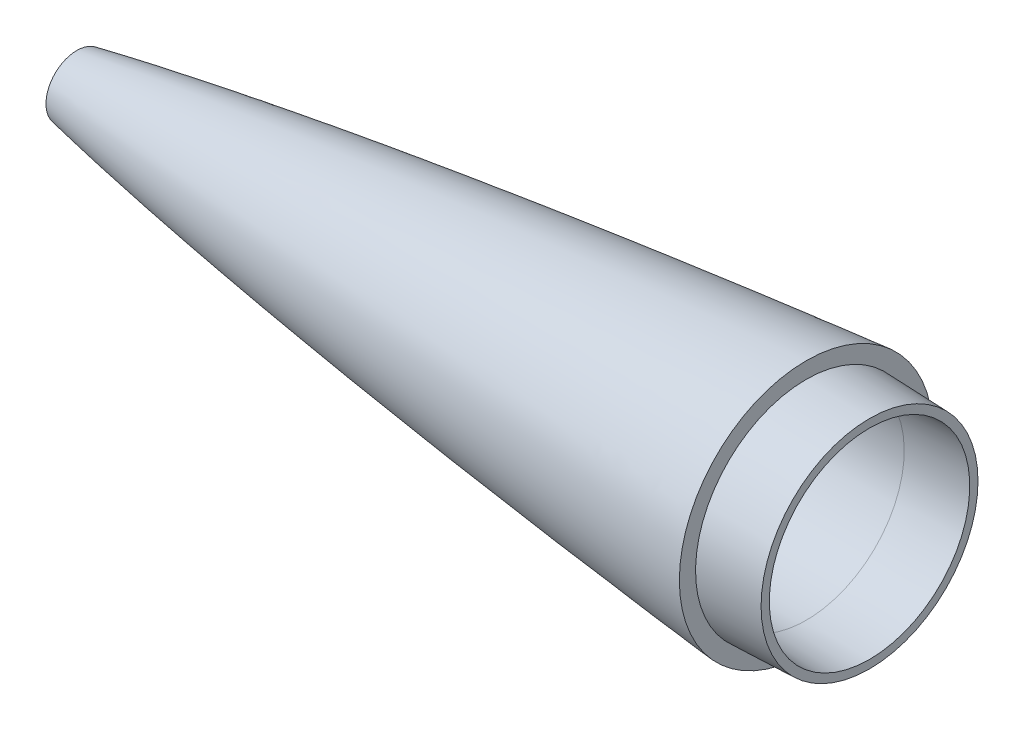
from build123d import *

# Parameters (mm, degrees)
SKETCH15_R         = 7.1
CUT_EXTRUDE1_DEPTH = 10
CUT_EXTRUDE1_DRAFT = -4


# Read off the part's stored shape, not the designer's step: Boss-Extrude1
with BuildPart() as part:
    # Sketch1 → Revolve1 (revolve)
    with BuildSketch(Plane.XY):
        with BuildLine():
            Line((-87.413336082, 34.5), (0, 34.5))
            Line((0, 34.5), (0, 39.5))
            Line((0, 39.5), (-10, 39.5))
            Line((-10, 39.5), (-10, 42.5))
            add(Edge.make_bspline(
                [(-410, 0), (-409.996104343, 0.009764497), (-409.985913153, 0.027949075), (-409.957510571, 0.059414303), (-409.898233488, 0.114206215), (-409.810537783, 0.179970098), (-409.676312366, 0.268169047), (-409.483787304, 0.379593537), (-409.212469032, 0.520885741), (-408.782228648, 0.722476645), (-408.063332817, 1.024430726), (-406.77961993, 1.501919518), (-404.418121728, 2.27068301), (-399.978466324, 3.520524256), (-392.218905515, 5.393132921), (-378.995085532, 8.137030847), (-360.816525389, 11.376409579), (-338.763877653, 14.839380374), (-314.223443016, 18.290822778), (-289.643356303, 21.444587663), (-265.032848706, 24.35089646), (-240.39799038, 27.041916752), (-215.742482432, 29.536512433), (-191.069036766, 31.846533123), (-166.379459519, 33.977380219), (-141.675128406, 35.929637856), (-120.046737987, 37.477295551), (-101.49987599, 38.68219301), (-86.03878208, 39.598684687), (-73.666707864, 40.275756821), (-61.291427842, 40.89196691), (-50.460249117, 41.371928643), (-41.174361888, 41.734883373), (-33.711978303, 41.990289017), (-28.074032831, 42.161616919), (-23.34821361, 42.285186922), (-19.53483297, 42.370797081), (-16.35677709, 42.429342551), (-13.814187886, 42.46970241), (-11.907137026, 42.488580832), (-10.635720501, 42.5), (-10, 42.5)],
                knots=[0, 0, 0, 0, 0, 0.000103977, 0.000207953, 0.000415907, 0.000802401, 0.001188895, 0.001801946, 0.002622264, 0.003837609, 0.005902977, 0.009538331, 0.016211507, 0.028478165, 0.051665798, 0.088742446, 0.150226816, 0.211711499, 0.273196106, 0.334680801, 0.396165351, 0.457649954, 0.519134578, 0.580619208, 0.642103779, 0.703588442, 0.765073032, 0.795815244, 0.826557457, 0.857299729, 0.888042002, 0.918784365, 0.934155547, 0.949526729, 0.962145047, 0.974763364, 0.981072523, 0.987381682, 0.993690841, 1, 1, 1, 1, 1], degree=4))
            Line((-410, 0), (-393.098004327, 0))
            ThreePointArc((-393.098004327, 0), (-240.900922824, 22.967212555), (-87.413336082, 34.5))
        make_face()
    revolve(axis=Axis((-393.098004327, 0, 0), (-1, 0, 0)))

    # SurfaceCut1
    split(bisect_by=Plane(origin=(-210, 0, 0), x_dir=(0, 0, -1), z_dir=(1, 0, 0)), keep=Keep.BOTTOM)

    # Boss-Extrude1 outline → Boss-Extrude1 (revolve)
    with BuildSketch(Plane.YX):
        Polygon((25.694975193, -195), (23.742598278, -195), (23.218786735, -210), (23.218786735, -238.660865761), (26.218786735, -238.660865761), (26.218786735, -210), align=None)
    revolve(axis=Axis((0, 0, 0), (1, 0, 0)))

    # SurfaceCut2
    split(bisect_by=Plane(origin=(-382.8, 0, 0), x_dir=(0, 0, -1), z_dir=(1, 0, 0)), keep=Keep.TOP)


with BuildPart() as cut_extrude1_tool:
    # Sketch15 → Cut-Extrude1 (with draft: the straight prism first)
    with BuildSketch(Plane.ZY.offset(382.8)):
        Circle(SKETCH15_R)
    extrude(amount=-CUT_EXTRUDE1_DEPTH)
    # Cut-Extrude1: the draft: its side faces are tilted about the plane it starts from
    cut_extrude1_sides = [cut_extrude1_tool.faces().sort_by_distance(p)[0] for p in [
        (-377.8, 0, -7.1),
    ]]
    draft(cut_extrude1_sides, Plane.ZY.offset(382.8), CUT_EXTRUDE1_DRAFT)


with BuildPart() as part_1:
    add(part.part)

    # Cut-Extrude1: cut by cut_extrude1_tool
    add(cut_extrude1_tool.part, mode=Mode.SUBTRACT)


solid = part_1.part
